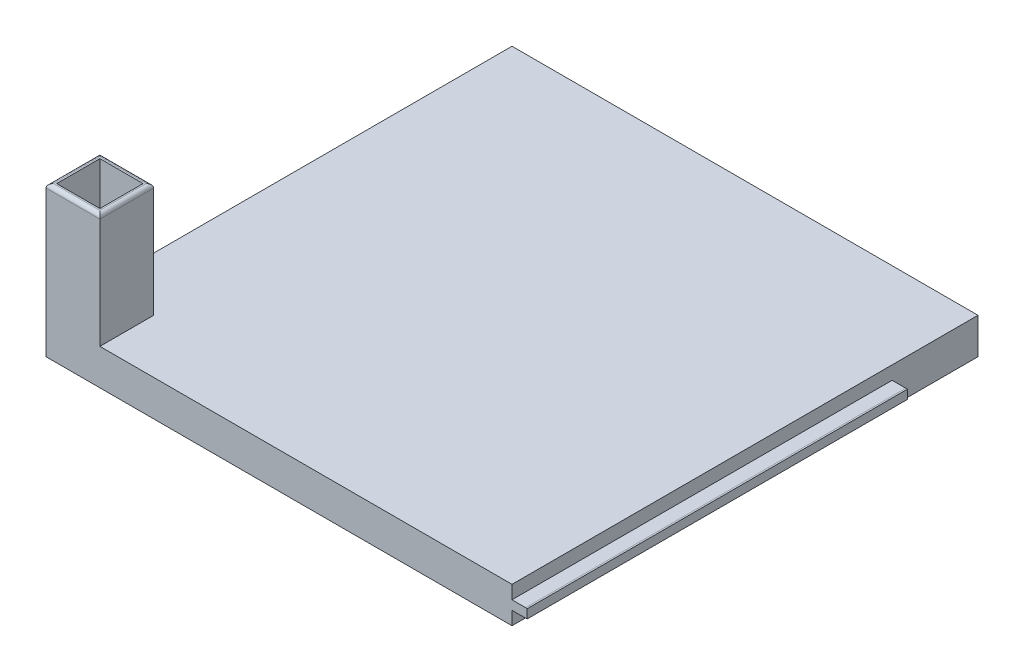
from build123d import *

# Parameters (mm, degrees)
SKETCH1_W           = 155.7
SKETCH1_H           = 155.7
BOSS_EXTRUDE2_DEPTH = 12
SKETCH2_W           = 18
SKETCH2_H           = 18
BOSS_EXTRUDE3_DEPTH = 38.1
SKETCH3_W           = 5.08
SKETCH3_H           = 3.048
BOSS_EXTRUDE4_DEPTH = 127
CHAMFER1_SIZE       = 0.508
CHAMFER1_SIZE2      = 0.03552282
CHAMFER2_SIZE       = 0.508
CHAMFER2_SIZE2      = 0.03552282
SKETCH4_W           = 5.334
SKETCH4_H           = 3.175
CUT_EXTRUDE3_DEPTH  = 149.86
SHELL1_START        = -20.543212121
SHELL1_DEPTH        = 152.144
SHELL1_2_OUTLINE_W  = 39.878
SHELL1_2_OUTLINE_H  = 14.444
SHELL1_2_DEPTH      = 14.444
SHELL1_START_2      = 129.316787879
SHELL1_3_OUTLINE_W  = 6.731
SHELL1_3_OUTLINE_H  = 5.334
SHELL1_3_DEPTH      = 2.284
FILLET1_R           = 1.27


# Read off the part's stored shape, not the designer's step: Shell1
with BuildPart() as part:
    # Sketch1 → Boss-Extrude2 (new body)
    with BuildSketch(Plane(origin=(0, 0, 0), x_dir=(1, 0, 0), z_dir=(0, 1, 0))):
        with Locations((55.528787879, -61.975)):
            Rectangle(SKETCH1_W, SKETCH1_H)
    extrude(amount=BOSS_EXTRUDE2_DEPTH)

    # Sketch2 → Boss-Extrude3 (add)
    with BuildSketch(Plane(origin=(0, 12, 0), x_dir=(1, 0, 0), z_dir=(0, 1, 0))):
        with Locations((-13.321212121, -130.825)):
            Rectangle(SKETCH2_W, SKETCH2_H)
    extrude(amount=BOSS_EXTRUDE3_DEPTH)

    # Sketch3 → Boss-Extrude4 (add)
    with BuildSketch(Plane.XY.offset(139.825)):
        with Locations((135.918787879, 6)):
            Rectangle(SKETCH3_W, SKETCH3_H)
    extrude(amount=-BOSS_EXTRUDE4_DEPTH)

    # Chamfer1
    chamfer1_edges = [part.edges().sort_by_distance(p)[0] for p in [
        (138.458787879, 7.524, 76.325),
    ]]
    chamfer1_side = [part.faces().sort_by_distance(p)[0] for p in [
        (135.918787879, 7.524, 76.325),
    ]]
    chamfer(chamfer1_edges, length=CHAMFER1_SIZE, length2=CHAMFER1_SIZE2, reference=chamfer1_side[0])

    # Chamfer2
    chamfer2_edges = [part.edges().sort_by_distance(p)[0] for p in [
        (138.458787879, 4.476, 76.325),
    ]]
    chamfer2_side = [part.faces().sort_by_distance(p)[0] for p in [
        (135.918787879, 4.476, 76.325),
    ]]
    chamfer(chamfer2_edges, length=CHAMFER2_SIZE, length2=CHAMFER2_SIZE2, reference=chamfer2_side[0])

    # Sketch4 → Cut-Extrude3 (cut)
    with BuildSketch(Plane.ZY.offset(22.321212121)):
        with Locations((-13.208, 6)):
            Rectangle(SKETCH4_W, SKETCH4_H)
    extrude(amount=-CUT_EXTRUDE3_DEPTH, mode=Mode.SUBTRACT)

    # Shell1 outline → Shell1 (cut)
    with BuildSketch(Plane.YZ.offset(SHELL1_START)):
        Polygon((10.222, 138.047), (1.778, 138.047), (1.778, -14.097), (2.6345, -14.097), (2.6345, -8.763), (9.3655, -8.763), (9.3655, -14.097), (10.222, -14.097), align=None)
    extrude(amount=SHELL1_DEPTH, mode=Mode.SUBTRACT)

    # Shell1 2 outline → Shell1 2 (cut)
    with BuildSketch(Plane.YZ.offset(SHELL1_START)):
        with Locations((30.161, 130.825)):
            Rectangle(SHELL1_2_OUTLINE_W, SHELL1_2_OUTLINE_H)
    extrude(amount=SHELL1_2_DEPTH, mode=Mode.SUBTRACT)

    # Shell1 3 outline → Shell1 3 (cut)
    with BuildSketch(Plane.YZ.offset(SHELL1_START_2)):
        with Locations((6, -11.43)):
            Rectangle(SHELL1_3_OUTLINE_W, SHELL1_3_OUTLINE_H)
    extrude(amount=SHELL1_3_DEPTH, mode=Mode.SUBTRACT)

    # Fillet1
    fillet1_edges = [part.edges().sort_by_distance(p)[0] for p in [
        (-22.321212121, 50.1, 130.825),
        (-13.321212121, 50.1, 139.825),
        (-4.321212121, 50.1, 130.825),
        (-13.321212121, 50.1, 121.825),
    ]]
    fillet(fillet1_edges, radius=FILLET1_R)


solid = part.part
